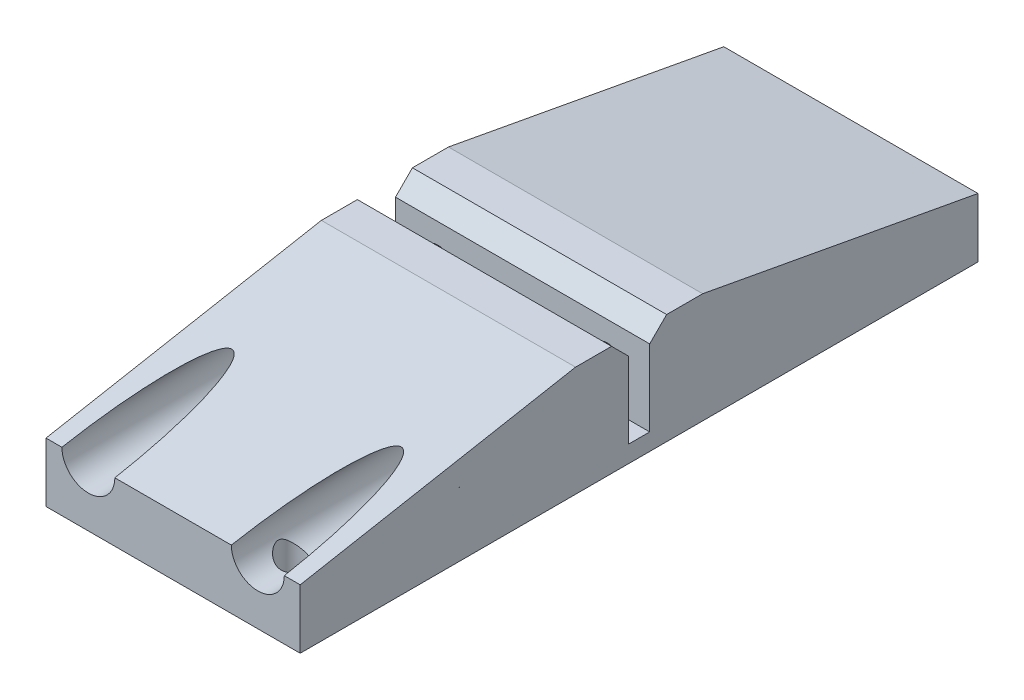
from build123d import *

# Parameters (mm, degrees)
SKETCH1_W               = 38.1
SKETCH1_H               = 101.6
BOSS_EXTRUDE1_DEPTH     = 16.51
SKETCH1_3_R             = 2.032
CUT_EXTRUDE1_DEPTH      = 9.525
CUT_EXTRUDE2_DEPTH      = 66.611204074
CUT_EXTRUDE2_DEPTH_BACK = 66.611204074
SKETCH3_W               = 38.1
SKETCH3_H               = 3.175
CUT_EXTRUDE3_DEPTH      = 13.97
CHAMFER1_SIZE           = 2.54
SKETCH5_R               = 2.032
CUT_EXTRUDE4_DEPTH      = 12.7
CUT_EXTRUDE6_REACH      = 63.014
SKETCH6_R               = 3.96875


with BuildPart() as part:
    # Sketch1 → Boss-Extrude1 (new body)
    with BuildSketch(Plane(origin=(0, 0, 0), x_dir=(1, 0, 0), z_dir=(0, 1, 0))):
        Rectangle(SKETCH1_W, SKETCH1_H)
    extrude(amount=BOSS_EXTRUDE1_DEPTH)

    # Sketch1<3> → Cut-Extrude1 (cut)
    with BuildSketch(Plane(origin=(0, 0, 0), x_dir=(1, 0, 0), z_dir=(0, 1, 0))):
        with Locations((-1.27, 44.45)):
            Circle(SKETCH1_3_R)
        with Locations((11.43, 44.45)):
            Circle(SKETCH1_3_R)
        with Locations((-1.27, -44.45)):
            Circle(SKETCH1_3_R)
        with Locations((11.43, -44.45)):
            Circle(SKETCH1_3_R)
    extrude(amount=CUT_EXTRUDE1_DEPTH, mode=Mode.SUBTRACT)

    # Sketch2 → Cut-Extrude2 (cut, two sides: drawn at the far end of the back side and taken through both)
    with BuildSketch(Plane(origin=(19.05, 0, 0), x_dir=(0, 0, -1), z_dir=(1, 0, 0)).offset(-CUT_EXTRUDE2_DEPTH_BACK)):
        Polygon((-50.8, 16.51), (-50.8, 8.89), (-9.525, 16.51), align=None)
        Polygon((50.8, 16.51), (9.525, 16.51), (50.8, 8.89), align=None)
    extrude(amount=CUT_EXTRUDE2_DEPTH + CUT_EXTRUDE2_DEPTH_BACK, mode=Mode.SUBTRACT)

    # Sketch3 → Cut-Extrude3 (cut)
    with BuildSketch(Plane(origin=(0, 16.51, 0), x_dir=(1, 0, 0), z_dir=(0, 1, 0))):
        Rectangle(SKETCH3_W, SKETCH3_H)
    extrude(amount=-CUT_EXTRUDE3_DEPTH, mode=Mode.SUBTRACT)

    # Chamfer1
    chamfer1_edges = [part.edges().sort_by_distance(p)[0] for p in [
        (0, 16.51, 1.5875),
        (0, 16.51, -1.5875),
    ]]
    chamfer(chamfer1_edges, length=CHAMFER1_SIZE)

    # Sketch5 → Cut-Extrude4 (cut, symmetric)
    with BuildSketch(Plane.XY.offset(-1.5875)):
        with Locations((-12.7, 8.89)):
            Circle(SKETCH5_R)
        with Locations((12.7, 8.89)):
            Circle(SKETCH5_R)
    extrude(amount=CUT_EXTRUDE4_DEPTH, both=True, mode=Mode.SUBTRACT)

    # Sketch6 → Cut-Extrude6 (cut, up to next)
    with BuildSketch(Plane(origin=(0, 0, 4.7625), x_dir=(-1, 0, 0), z_dir=(0, 0, -1)), mode=Mode.PRIVATE) as cut_extrude6_sk1:
        with Locations((-12.7, 8.89)):
            Circle(SKETCH6_R)
    cut_extrude6_tool1 = extrude(cut_extrude6_sk1.sketch, amount=-CUT_EXTRUDE6_REACH, mode=Mode.PRIVATE) & part.part
    # Sketch6 → Cut-Extrude6 (cut, up to next)
    with BuildSketch(Plane(origin=(0, 0, 4.7625), x_dir=(-1, 0, 0), z_dir=(0, 0, -1)), mode=Mode.PRIVATE) as cut_extrude6_sk2:
        with Locations((12.7, 8.89)):
            Circle(SKETCH6_R)
    cut_extrude6_tool2 = extrude(cut_extrude6_sk2.sketch, amount=-CUT_EXTRUDE6_REACH, mode=Mode.PRIVATE) & part.part
    add(cut_extrude6_tool1.solids().sort_by_distance((12.7, 8.89, 4.7625))[0], mode=Mode.SUBTRACT)
    add(cut_extrude6_tool2.solids().sort_by_distance((-12.7, 8.89, 4.7625))[0], mode=Mode.SUBTRACT)


solid = part.part
